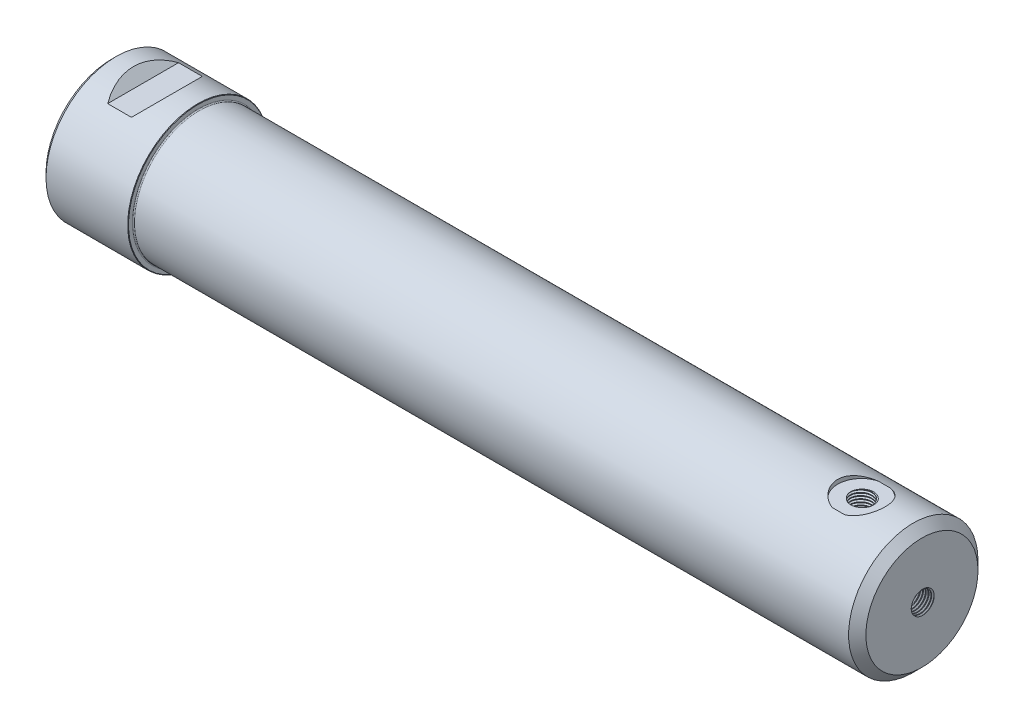
from build123d import *

# Parameters (mm, degrees)
F_7_16_20_TAPPED_HOLE2_D     = 9.92124
F_7_16_20_TAPPED_HOLE2_DEPTH = 26.04
F_7_16_20_TAPPED_HOLE2_TIP   = 2.980641204
CUT_EXTRUDE2_START           = 28
SKETCH15_R                   = 11
CUT_EXTRUDE2_DEPTH           = 350.810385155
CHAMFER8_SIZE                = 0.2
CHAMFER9_SIZE                = 0.5
CIRPATTERN1_COUNT            = 3
THREAD2_PITCH                = 1.27
THREAD3_PITCH                = 1.27
CHAMFER5_SIZE                = 0.2
FILLET4_R                    = 0.5
CHAMFER6_SIZE                = 2
CUT_EXTRUDE5_START           = 28
SKETCH25_W                   = 20
SKETCH25_H                   = 59.94376397
CUT_EXTRUDE5_DEPTH           = 350.810385155
CHAMFER7_SIZE                = 4.5
CHAMFER7_OF_MIRROR5_SIZE     = 4.5


with BuildPart() as part:
    # Sketch1 → Revolve1 (revolve)
    with BuildSketch(Plane(origin=(0, 0, 0), x_dir=(1, 0, 0), z_dir=(0, 1, 0))):
        Polygon((-375.012909285, 23.25), (-375.012909285, 32.45), (-335.012909285, 32.45), (-335.012909285, 29.95), (-4, 29.95), (0, 25.95), (0, 0), (-16, 0), (-25.012909285, 15), (-328.637909285, 15), (-329.512909285, 15.875), (-371.012909285, 15.875), (-371.012909285, 23.25), align=None)
    revolve(axis=Axis((0, 0, 0), (-1, 0, 0)))

    # 7/16-20 Tapped Hole2
    with Locations(Plane(origin=(0, 0, 0), x_dir=(0, 0, -1), z_dir=(1, 0, 0))):
        with Locations((0, 0)):
            Hole(F_7_16_20_TAPPED_HOLE2_D / 2, depth=F_7_16_20_TAPPED_HOLE2_DEPTH)
            with Locations((0, 0, -(F_7_16_20_TAPPED_HOLE2_DEPTH + F_7_16_20_TAPPED_HOLE2_TIP / 2))):  # 118° drill point
                Cone(0, F_7_16_20_TAPPED_HOLE2_D / 2, F_7_16_20_TAPPED_HOLE2_TIP, mode=Mode.SUBTRACT)

    # Sketch15 → Cut-Extrude2 (cut, through all)
    with BuildSketch(Plane(origin=(0, 0, 0), x_dir=(1, 0, 0), z_dir=(0, 1, 0)).offset(CUT_EXTRUDE2_START)):
        with Locations((-28, 0)):
            Circle(SKETCH15_R)
    cut_extrude2 = extrude(amount=CUT_EXTRUDE2_DEPTH, mode=Mode.SUBTRACT)

    # Sketch17 → 7/16-20 Tapped Hole3 (revolve, cut)
    with BuildSketch(Plane(origin=(-28, 28, 0), x_dir=(0, 0, 1), z_dir=(1, 0, 0))):
        Polygon((0, 0), (0, 29.020641204), (4.96062, 26.04), (4.96062, 0), align=None)
    f_7_16_20_tapped_hole3 = revolve(axis=Axis((-28, 34.35, 0), (0, -1, 0)), mode=Mode.SUBTRACT)

    # Mirror4: Cut-Extrude2, 7/16-20 Tapped Hole3 across plane
    add(cut_extrude2.mirror(Plane.ZX), mode=Mode.SUBTRACT)
    add(f_7_16_20_tapped_hole3.mirror(Plane.ZX), mode=Mode.SUBTRACT)

    # Chamfer8
    chamfer8_edges = [part.edges().sort_by_distance(p)[0] for p in [
        (-375.012909285, 0, 23.25),
    ]]
    chamfer(chamfer8_edges, length=CHAMFER8_SIZE)

    # Chamfer9
    chamfer9_edges = [part.edges().sort_by_distance(p)[0] for p in [
        (-371.012909285, 0, 15.875),
    ]]
    chamfer(chamfer9_edges, length=CHAMFER9_SIZE)

    # Sketch21 → M3x0.5 Tapped Hole1 (revolve, cut)
    with BuildSketch(Plane(origin=(-371.012909285, 0, -19), x_dir=(0, 0, 1), z_dir=(0, 1, 0))):
        Polygon((0, 0), (0, 8.251075774), (1.25, 7.5), (1.25, 0), align=None)
    m3x0_5_tapped_hole1 = revolve(axis=Axis((-377.362909285, 0, -19), (1, 0, 0)), mode=Mode.SUBTRACT)

    # CirPattern1: M3x0.5 Tapped Hole1 ×3 about axis
    cirpattern1_axis = Axis((0, 0, 0), (1, 0, 0))
    for i in range(1, CIRPATTERN1_COUNT):
        add(m3x0_5_tapped_hole1.rotate(cirpattern1_axis, i * 360 / CIRPATTERN1_COUNT), mode=Mode.SUBTRACT)

    # Thread2: arcs per turn and ends read off the stored shape
    # Thread2: the profile of Thread Profile3 profile screwed along a right-hand helix through 64 turns, 6 arcs to a turn; built about Z, then put on its axis
    thread2_z = Axis((0, 0, 0), (0, 0, 1))
    thread2_corners = [(4.96032, 0, -0.000173205), (5.648027661, 0, 0.396874998), (5.648027661, 0, 0.555624998), (4.96032, 0, 0.952673202)]
    with BuildLine(mode=Mode.PRIVATE) as thread2_profile:
        Line(thread2_corners[0], thread2_corners[1])
        Line(thread2_corners[1], thread2_corners[2])
        Line(thread2_corners[2], thread2_corners[3])
        Line(thread2_corners[3], thread2_corners[0])
    thread2_cap = Face(thread2_profile.wire())
    thread2_turn_angles = [0, 30, 60, 90, 120, 150, 180, 210, 240, 270, 300, 330, 360]
    thread2_turn_weights = [1, 0.8660254037844387, 1, 0.8660254037844387, 1, 0.8660254037844387, 1, 0.8660254037844387, 1, 0.8660254037844387, 1, 0.8660254037844387, 1]
    thread2_turn_rails = [Edge.make_bspline([Vector(p[0], p[1], 0).rotate(thread2_z, thread2_turn_angles[k]) / thread2_turn_weights[k] + Vector(0, 0, p[2] + THREAD2_PITCH * thread2_turn_angles[k] / 360) for k in range(13)], [0, 0, 0, 1, 1, 2, 2, 3, 3, 4, 4, 5, 5, 6, 6, 6], 2, thread2_turn_weights) for p in thread2_corners]
    thread2_turn_sides = [Face.make_surface_from_curves(thread2_turn_rails[p[0]], thread2_turn_rails[p[1]]) for p in [(0, 1), (1, 2), (2, 3), (3, 0)]]
    thread2 = Plane(origin=(-28, 38, 0), x_dir=(-1, 0, 0), z_dir=(0, -1, 0)) * Solid(Shell([*[p.moved(Location((0, 0, THREAD2_PITCH * i))) for i in range(64) for p in thread2_turn_sides], thread2_cap, thread2_cap.rotate(thread2_z, 23040).moved(Location((0, 0, THREAD2_PITCH * 23040 / 360)))]))
    add(thread2, mode=Mode.SUBTRACT)

    # Thread3: arcs per turn and ends read off the stored shape
    # Thread3: the profile of Thread Profile4 profile screwed along a right-hand helix through 64 turns, 6 arcs to a turn; built about Z, then put on its axis
    thread3_z = Axis((0, 0, 0), (0, 0, 1))
    thread3_corners = [(4.96032, 0, -0.000173205), (5.648027661, 0, 0.396874998), (5.648027661, 0, 0.555624998), (4.96032, 0, 0.952673202)]
    with BuildLine(mode=Mode.PRIVATE) as thread3_profile:
        Line(thread3_corners[0], thread3_corners[1])
        Line(thread3_corners[1], thread3_corners[2])
        Line(thread3_corners[2], thread3_corners[3])
        Line(thread3_corners[3], thread3_corners[0])
    thread3_cap = Face(thread3_profile.wire())
    thread3_turn_angles = [0, 30, 60, 90, 120, 150, 180, 210, 240, 270, 300, 330, 360]
    thread3_turn_weights = [1, 0.8660254037844387, 1, 0.8660254037844387, 1, 0.8660254037844387, 1, 0.8660254037844387, 1, 0.8660254037844387, 1, 0.8660254037844387, 1]
    thread3_turn_rails = [Edge.make_bspline([Vector(p[0], p[1], 0).rotate(thread3_z, thread3_turn_angles[k]) / thread3_turn_weights[k] + Vector(0, 0, p[2] + THREAD3_PITCH * thread3_turn_angles[k] / 360) for k in range(13)], [0, 0, 0, 1, 1, 2, 2, 3, 3, 4, 4, 5, 5, 6, 6, 6], 2, thread3_turn_weights) for p in thread3_corners]
    thread3_turn_sides = [Face.make_surface_from_curves(thread3_turn_rails[p[0]], thread3_turn_rails[p[1]]) for p in [(0, 1), (1, 2), (2, 3), (3, 0)]]
    thread3 = Plane(origin=(10, 0, 0), x_dir=(0, 0, 1), z_dir=(-1, 0, 0)) * Solid(Shell([*[p.moved(Location((0, 0, THREAD3_PITCH * i))) for i in range(64) for p in thread3_turn_sides], thread3_cap, thread3_cap.rotate(thread3_z, 23040).moved(Location((0, 0, THREAD3_PITCH * 23040 / 360)))]))
    add(thread3, mode=Mode.SUBTRACT)

    # Chamfer5
    chamfer5_edges = [part.edges().sort_by_distance(p)[0] for p in [
        (-335.012909285, 0, 32.45),
    ]]
    chamfer(chamfer5_edges, length=CHAMFER5_SIZE)

    # Fillet4
    fillet4_edges = [part.edges().sort_by_distance(p)[0] for p in [
        (-335.012909285, 0, 29.95),
    ]]
    fillet(fillet4_edges, radius=FILLET4_R)

    # Chamfer6
    chamfer6_edges = [part.edges().sort_by_distance(p)[0] for p in [
        (-375.012909285, 0, 32.45),
    ]]
    chamfer(chamfer6_edges, length=CHAMFER6_SIZE)

    # Sketch25 → Cut-Extrude5 (cut, through all)
    with BuildSketch(Plane(origin=(0, 0, 0), x_dir=(1, 0, 0), z_dir=(0, 1, 0)).offset(CUT_EXTRUDE5_START)):
        with Locations((-355.012909285, 0)):
            Rectangle(SKETCH25_W, SKETCH25_H)
    cut_extrude5 = extrude(amount=CUT_EXTRUDE5_DEPTH, mode=Mode.SUBTRACT)

    # Chamfer7
    # the kernel refuses this chamfer: 4.5 mm, written as the material it adds along each edge
    with BuildSketch(Plane(origin=(-365.012909285, 28, -27.973869126), x_dir=(1, 0, 0), z_dir=(0, 0, 1))) as chamfer7_piece_1_section:
        Polygon((CHAMFER7_SIZE, 0), (0, CHAMFER7_SIZE), (0, 0), align=None)
    chamfer7_piece_1 = extrude(amount=55.947738253, mode=Mode.PRIVATE)
    chamfer7_piece_1 = chamfer7_piece_1 & Plane(origin=(-365.012909285, 0, 0), x_dir=(0, 0, -1), z_dir=(1, 0, 0)) * Cylinder(32.45, 130, mode=Mode.PRIVATE)
    add(chamfer7_piece_1)
    with BuildSketch(Plane(origin=(-345.012909285, 28, 27.973869126), x_dir=(0, 1, 0), z_dir=(0, 0, -1))) as chamfer7_piece_2_section:
        Polygon((CHAMFER7_SIZE, 0), (0, -CHAMFER7_SIZE), (0, 0), align=None)
    chamfer7_piece_2 = extrude(amount=55.947738253, mode=Mode.PRIVATE)
    chamfer7_piece_2 = chamfer7_piece_2 & Plane(origin=(-345.012909285, 0, 0), x_dir=(0, 0, -1), z_dir=(1, 0, 0)) * Cylinder(32.45, 130, mode=Mode.PRIVATE)
    add(chamfer7_piece_2)

    # Mirror5: Cut-Extrude5 across plane
    add(cut_extrude5.mirror(Plane.ZX), mode=Mode.SUBTRACT)

    # Chamfer7 of Mirror5
    # the kernel refuses this chamfer: 4.5 mm, written as the material it adds along each edge
    with BuildSketch(Plane(origin=(-365.012909285, -28, -27.973869126), x_dir=(1, 0, 0), z_dir=(0, 0, 1))) as chamfer7_of_mirror5_piece_1_section:
        Polygon((CHAMFER7_OF_MIRROR5_SIZE, 0), (0, -CHAMFER7_OF_MIRROR5_SIZE), (0, 0), align=None)
    chamfer7_of_mirror5_piece_1 = extrude(amount=55.947738253, mode=Mode.PRIVATE)
    chamfer7_of_mirror5_piece_1 = chamfer7_of_mirror5_piece_1 & Plane(origin=(-365.012909285, 0, 0), x_dir=(0, 0, -1), z_dir=(1, 0, 0)) * Cylinder(32.45, 130, mode=Mode.PRIVATE)
    add(chamfer7_of_mirror5_piece_1)
    with BuildSketch(Plane(origin=(-345.012909285, -28, 27.973869126), x_dir=(-1, 0, 0), z_dir=(0, 0, -1))) as chamfer7_of_mirror5_piece_2_section:
        Polygon((CHAMFER7_OF_MIRROR5_SIZE, 0), (0, -CHAMFER7_OF_MIRROR5_SIZE), (0, 0), align=None)
    chamfer7_of_mirror5_piece_2 = extrude(amount=55.947738253, mode=Mode.PRIVATE)
    chamfer7_of_mirror5_piece_2 = chamfer7_of_mirror5_piece_2 & Plane(origin=(-345.012909285, 0, 0), x_dir=(0, 0, -1), z_dir=(1, 0, 0)) * Cylinder(32.45, 130, mode=Mode.PRIVATE)
    add(chamfer7_of_mirror5_piece_2)


solid = part.part
